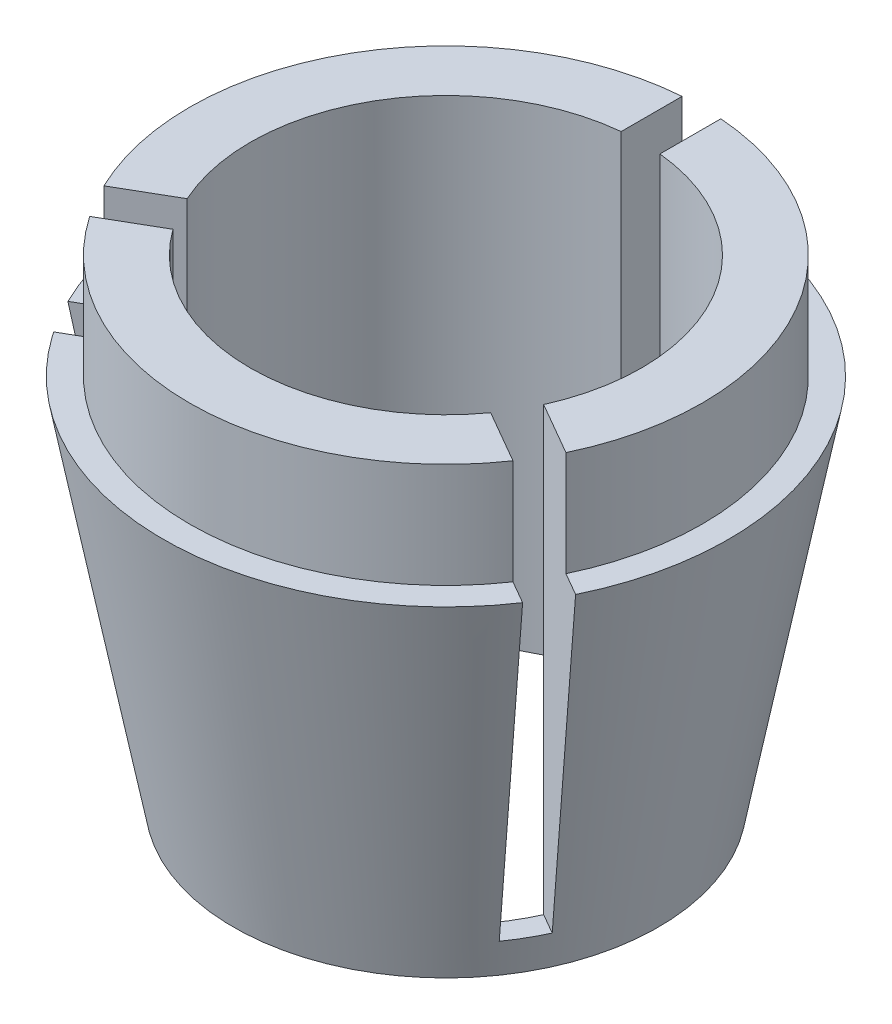
from build123d import *

# Parameters (mm, degrees)
CUT_EXTRUDE_THIN1_START = -65.5
CUT_EXTRUDE_THIN1_DEPTH = 65.5


# Read off the part's stored shape, not the designer's step: Cut-Extrude-Thin1
with BuildPart() as part:
    # Sketch3 → Revolve1 (revolve)
    with BuildSketch(Plane.XY, mode=Mode.PRIVATE) as revolve1_sk:
        Polygon((-38, 55), (-38, 70.548970685), (-29, 70.548970685), (-29, 55), (-29, 0), (-31.5, 0), (-41.9, 55), align=None)
    revolve(revolve1_sk.sketch.rotate(Axis((0, 0, 0), (0, 1, 0)), 270), axis=Axis((0, 0, 0), (0, 1, 0)))

    # Cut-Extrude-Thin1 outline → Cut-Extrude-Thin1 (cut)
    with BuildSketch(Plane(origin=(0, 70.548970685, 0), x_dir=(1, 0, 0), z_dir=(0, 1, 0)).offset(CUT_EXTRUDE_THIN1_START)):
        Polygon((2.875, 4.979646072), (2.875, 43), (-2.875, 43), (-2.875, 4.979646072), (0, 3.319764048), align=None)
        Polygon((5.75, 0), (2.875, -1.659882024), (2.875, -4.979646072), (23.55351401, -16.918391702), (34.763443099, -23.390447279), (37.551270189, -25), (39, -25), (39, -19.19689645), (37.638443099, -18.410801207), (26.42851401, -11.93874563), align=None)
        Polygon((-2.875, -4.979646072), (-2.875, -1.659882024), (-5.75, 0), (-26.42851401, -11.93874563), (-37.638443099, -18.410801207), (-39, -19.19689645), (-39, -25), (-37.551270189, -25), (-34.763443099, -23.390447279), (-23.55351401, -16.918391702), align=None)
    extrude(amount=CUT_EXTRUDE_THIN1_DEPTH, mode=Mode.SUBTRACT)


solid = part.part
